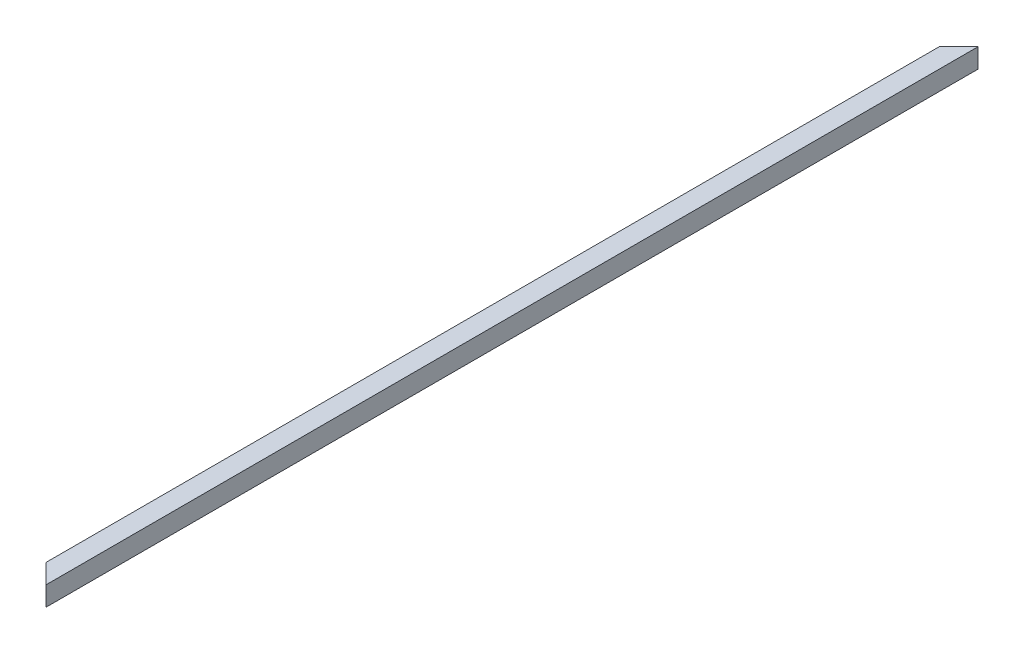
from build123d import *

# Parameters (mm, degrees)
BOSS_EXTRUDE1_DEPTH = 1219.2
CHAMFER1_SIZE       = 25.4


with BuildPart() as part:
    # Sketch1 → Boss-Extrude1 (new body)
    with BuildSketch(Plane.XY):
        Polygon((0, 0), (0, -25.4), (-6.35, -25.4), (-6.35, -6.35), (-25.4, -6.35), (-25.4, 0), align=None)
    extrude(amount=BOSS_EXTRUDE1_DEPTH)

    # Chamfer1
    chamfer1_edges = [part.edges().sort_by_distance(p)[0] for p in [
        (-25.4, -3.175, 0),
        (-25.4, -3.175, 1219.2),
    ]]
    chamfer(chamfer1_edges, length=CHAMFER1_SIZE - 0.0001)  # a hair under: the kernel refuses the full size


solid = part.part
